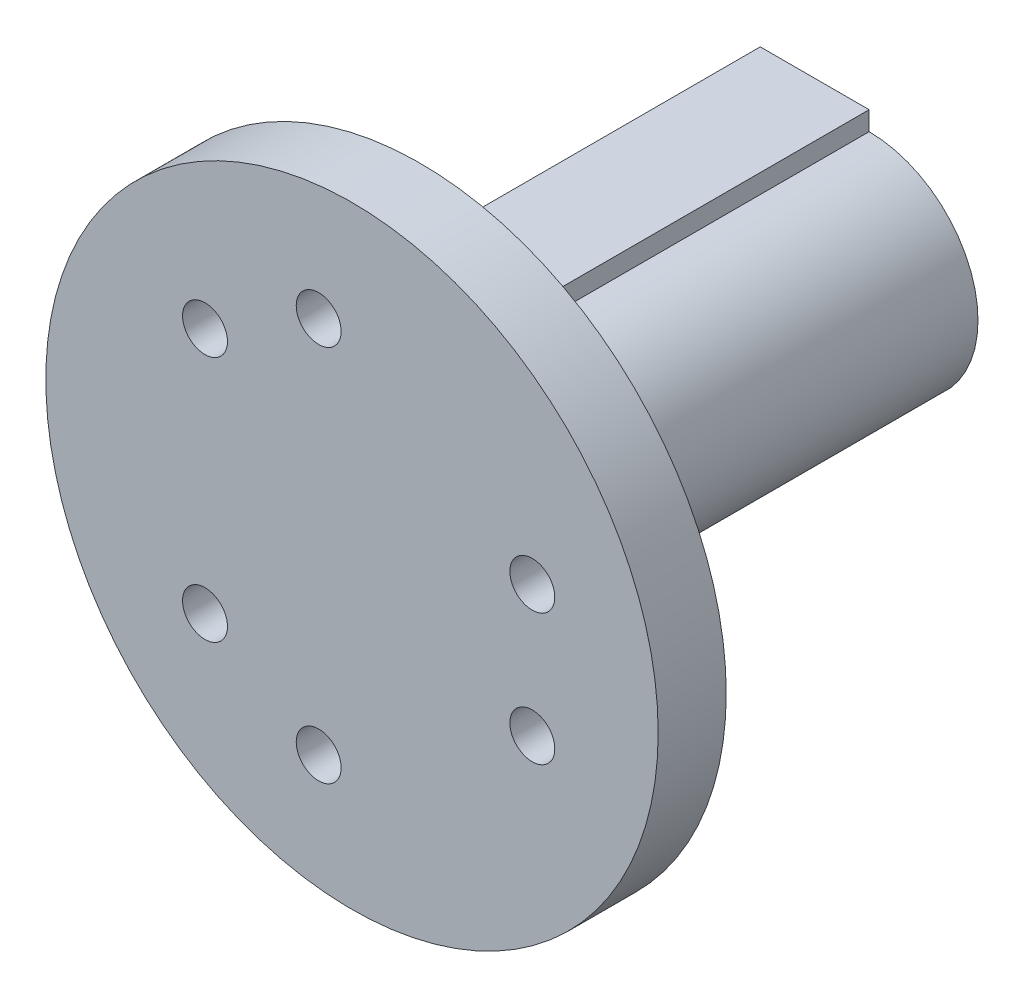
from build123d import *

# Parameters (mm, degrees)
SKETCH_1_R               = 22.5
SKETCH_1_R_2             = 1.65
EXTRUDE_1_DEPTH          = 5
SKETCH_3_R               = 3
CUT_EXTRUDE_1_DEPTH      = 2
SKETCH_11_R              = 8
EXTRUDE_2_DEPTH          = 25
CUT_EXTRUDE_9_DEPTH      = 25
CUT_EXTRUDE_9_DEPTH_BACK = 25
SKETCH_12_W              = 8
SKETCH_12_H              = 15
SKETCH_13_W              = 15
SKETCH_13_H              = 18.8
EXTRUDE_3_DEPTH          = 8
EXTRUDE_5_DEPTH          = 8


with BuildPart() as part:
    # 스케치1 → 보스-돌출1 (new body)
    with BuildSketch(Plane.XY):
        Circle(SKETCH_1_R)
        with Locations((-2.448439305, 13.885789317)):
            Circle(SKETCH_1_R_2, mode=Mode.SUBTRACT)
        with Locations((-10.801226648, 9.063305297)):
            Circle(SKETCH_1_R_2, mode=Mode.SUBTRACT)
        with Locations((13.249665953, 4.822484021)):
            Circle(SKETCH_1_R_2, mode=Mode.SUBTRACT)
        with Locations((13.249665953, -4.822484021)):
            Circle(SKETCH_1_R_2, mode=Mode.SUBTRACT)
        with Locations((-2.448439305, -13.885789317)):
            Circle(SKETCH_1_R_2, mode=Mode.SUBTRACT)
        with Locations((-10.801226648, -9.063305297)):
            Circle(SKETCH_1_R_2, mode=Mode.SUBTRACT)
    extrude(amount=EXTRUDE_1_DEPTH)

    # 스케치3 → 컷-돌출1 (cut)
    with BuildSketch(Plane(origin=(0, 0, 0), x_dir=(-1, 0, 0), z_dir=(0, 0, -1))):
        with Locations((2.448439305, 13.885789317)):
            Circle(SKETCH_3_R)
        with Locations((10.801226648, 9.063305297)):
            Circle(SKETCH_3_R)
        with Locations((10.801226648, -9.063305297)):
            Circle(SKETCH_3_R)
        with Locations((2.448439305, -13.885789317)):
            Circle(SKETCH_3_R)
        with Locations((-13.249665953, -4.822484021)):
            Circle(SKETCH_3_R)
        with Locations((-13.249665953, 4.822484021)):
            Circle(SKETCH_3_R)
    extrude(amount=-CUT_EXTRUDE_1_DEPTH, mode=Mode.SUBTRACT)

    # 스케치11 → 보스-돌출2 (add)
    with BuildSketch(Plane(origin=(0, 0, 0), x_dir=(-1, 0, 0), z_dir=(0, 0, -1))):
        Circle(SKETCH_11_R)
    extrude(amount=EXTRUDE_2_DEPTH)

    # 스케치12 → 컷-돌출9 (cut, two sides: drawn at the far end of the back side and taken through both)
    with BuildSketch(Plane(origin=(0, 0, 0), x_dir=(1, 0, 0), z_dir=(0, 1, 0)).offset(-CUT_EXTRUDE_9_DEPTH_BACK)):
        with Locations((-4, 17.5)):
            Rectangle(SKETCH_12_W, SKETCH_12_H)
    extrude(amount=CUT_EXTRUDE_9_DEPTH + CUT_EXTRUDE_9_DEPTH_BACK, mode=Mode.SUBTRACT)

    # 스케치13 → 보스-돌출3 (add)
    with BuildSketch(Plane.ZY):
        with Locations((-17.5, 0)):
            Rectangle(SKETCH_13_W, SKETCH_13_H)
    extrude(amount=EXTRUDE_3_DEPTH)

    # 스케치15 → 보스-돌출5 (add)
    with BuildSketch(Plane(origin=(0, 0, -25), x_dir=(-1, 0, 0), z_dir=(0, 0, -1))):
        with BuildLine():
            Line((0, 8), (0, 9.4))
            Line((0, 9.4), (8, 9.4))
            Line((8, 9.4), (8, -9.4))
            Line((8, -9.4), (0, -9.4))
            Line((0, -9.4), (0, -8))
            ThreePointArc((0, -8), (-8, 0), (0, 8))
        make_face()
    extrude(amount=EXTRUDE_5_DEPTH)


solid = part.part
